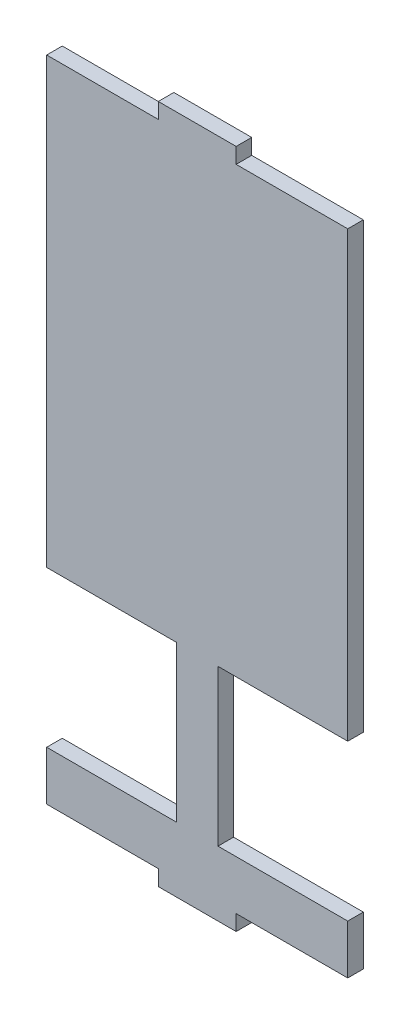
from build123d import *

# Parameters (mm, degrees)
ESQUISSE1_W             = 116
ESQUISSE1_H             = 250
BOSS_EXTRU_1_DEPTH      = 6
ESQUISSE2_W             = 30
ESQUISSE2_H             = 6
BOSS_EXTRU_2_DEPTH      = 6
ESQUISSE3_W             = 50
ESQUISSE3_H             = 60
ENL_V_MAT_EXTRU_1_DEPTH = 6


with BuildPart() as part:
    # Esquisse1 → Boss.-Extru.1 (new body)
    with BuildSketch(Plane.XY):
        Rectangle(ESQUISSE1_W, ESQUISSE1_H)
    extrude(amount=BOSS_EXTRU_1_DEPTH)

    # Esquisse2 → Boss.-Extru.2 (add)
    with BuildSketch(Plane.XY.offset(6)):
        with Locations((0, -128)):
            Rectangle(ESQUISSE2_W, ESQUISSE2_H)
        with Locations((0, 128)):
            Rectangle(ESQUISSE2_W, ESQUISSE2_H)
    extrude(amount=-BOSS_EXTRU_2_DEPTH)

    # Esquisse3 → Enlèv. mat.-Extru.1 (cut)
    with BuildSketch(Plane.XY.offset(6)):
        with Locations((33, -76)):
            Rectangle(ESQUISSE3_W, ESQUISSE3_H)
        with Locations((-33, -76)):
            Rectangle(ESQUISSE3_W, ESQUISSE3_H)
    extrude(amount=-ENL_V_MAT_EXTRU_1_DEPTH, mode=Mode.SUBTRACT)


solid = part.part
